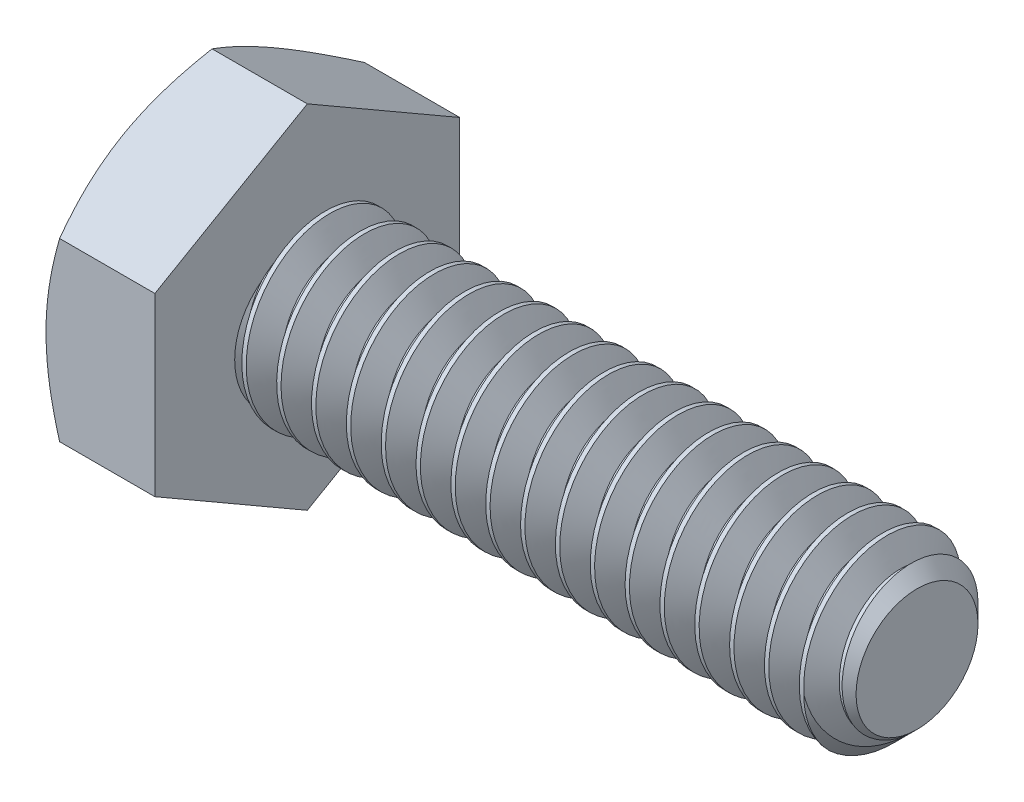
from build123d import *

# Parameters (mm, degrees)
SKETCH5_R           = 3.175
BOSS_EXTRUDE3_DEPTH = 22.225
CHAMFER1_SIZE       = 0.9525
CUT_SWEEP1_PITCH    = 1.27
BOSS_EXTRUDE4_DEPTH = 3.96875
SKETCH8_OUTSIDE_W   = 118.2
SKETCH8_OUTSIDE_H   = 119.92
SKETCH8_OUTSIDE_R   = 5.55625
CUT_EXTRUDE3_DEPTH  = 28.53446954
CUT_EXTRUDE3_DRAFT  = -60


with BuildPart() as part:
    # Sketch5 → Boss-Extrude3 (new body)
    with BuildSketch(Plane(origin=(13.096875, 0, 0), x_dir=(0, 0, -1), z_dir=(1, 0, 0))):
        Circle(SKETCH5_R)
    extrude(amount=-BOSS_EXTRUDE3_DEPTH)

    # Chamfer1
    chamfer1_edges = [part.edges().sort_by_distance(p)[0] for p in [
        (13.096875, 0, 3.175),
    ]]
    chamfer(chamfer1_edges, length=CHAMFER1_SIZE)

    # Cut-Sweep1: the profile of Sketch10 profile screwed along a right-hand helix of 18.5 turns, 8 arcs to a turn; built about Z, then put on its axis
    cut_sweep1_z = Axis((0, 0, 0), (0, 0, 1))
    cut_sweep1_corners = [(3.1753, 0, 0.000173205), (2.350110803, 0, -0.47625), (2.350110803, 0, -0.635), (3.1753, 0, -1.111423205)]
    with BuildLine(mode=Mode.PRIVATE) as cut_sweep1_profile:
        Line(cut_sweep1_corners[0], cut_sweep1_corners[1])
        Line(cut_sweep1_corners[1], cut_sweep1_corners[2])
        Line(cut_sweep1_corners[2], cut_sweep1_corners[3])
        Line(cut_sweep1_corners[3], cut_sweep1_corners[0])
    cut_sweep1_cap = Face(cut_sweep1_profile.wire())
    cut_sweep1_turn_angles = [0, 22.5, 45, 67.5, 90, 112.5, 135, 157.5, 180, 202.5, 225, 247.5, 270, 292.5, 315, 337.5, 360]
    cut_sweep1_turn_weights = [1, 0.9238795325112867, 1, 0.9238795325112867, 1, 0.9238795325112867, 1, 0.9238795325112867, 1, 0.9238795325112867, 1, 0.9238795325112867, 1, 0.9238795325112867, 1, 0.9238795325112867, 1]
    cut_sweep1_turn_rails = [Edge.make_bspline([Vector(p[0], p[1], 0).rotate(cut_sweep1_z, cut_sweep1_turn_angles[k]) / cut_sweep1_turn_weights[k] + Vector(0, 0, p[2] + CUT_SWEEP1_PITCH * cut_sweep1_turn_angles[k] / 360) for k in range(17)], [0, 0, 0, 1, 1, 2, 2, 3, 3, 4, 4, 5, 5, 6, 6, 7, 7, 8, 8, 8], 2, cut_sweep1_turn_weights) for p in cut_sweep1_corners]
    cut_sweep1_turn_sides = [Face.make_surface_from_curves(cut_sweep1_turn_rails[p[0]], cut_sweep1_turn_rails[p[1]]) for p in [(0, 1), (1, 2), (2, 3), (3, 0)]]
    cut_sweep1_last_angles = [6480, 6502.5, 6525, 6547.5, 6570, 6592.5, 6615, 6637.5, 6660]
    cut_sweep1_last_weights = [1, 0.9238795325112867, 1, 0.9238795325112867, 1, 0.9238795325112867, 1, 0.9238795325111926, 1]
    cut_sweep1_last_rails = [Edge.make_bspline([Vector(p[0], p[1], 0).rotate(cut_sweep1_z, cut_sweep1_last_angles[k]) / cut_sweep1_last_weights[k] + Vector(0, 0, p[2] + CUT_SWEEP1_PITCH * cut_sweep1_last_angles[k] / 360) for k in range(9)], [0, 0, 0, 1, 1, 2, 2, 3, 3, 4, 4, 4], 2, cut_sweep1_last_weights) for p in cut_sweep1_corners]
    cut_sweep1_last_sides = [Face.make_surface_from_curves(cut_sweep1_last_rails[p[0]], cut_sweep1_last_rails[p[1]]) for p in [(0, 1), (1, 2), (2, 3), (3, 0)]]
    cut_sweep1 = Plane(origin=(13.096875, 0, 0), x_dir=(0, 1, 0), z_dir=(-1, 0, 0)) * Solid(Shell([*[p.moved(Location((0, 0, CUT_SWEEP1_PITCH * i))) for i in range(18) for p in cut_sweep1_turn_sides], *cut_sweep1_last_sides, cut_sweep1_cap, cut_sweep1_cap.rotate(cut_sweep1_z, 6660).moved(Location((0, 0, CUT_SWEEP1_PITCH * 6660 / 360)))]))
    add(cut_sweep1, mode=Mode.SUBTRACT)

    # Sketch6 → Boss-Extrude4 (add)
    with BuildSketch(Plane.ZY.offset(9.128125)):
        Polygon((5.55625, 3.207902433), (0, 6.415804866), (-5.55625, 3.207902433), (-5.55625, -3.207902433), (0, -6.415804866), (5.55625, -3.207902433), align=None)
    extrude(amount=BOSS_EXTRUDE4_DEPTH)


with BuildPart() as cut_extrude3_tool:
    # Sketch8 outside → Cut-Extrude3 (with draft: the straight prism first)
    with BuildSketch(Plane.ZY.offset(13.096875)):
        Rectangle(SKETCH8_OUTSIDE_W, SKETCH8_OUTSIDE_H)
        Circle(SKETCH8_OUTSIDE_R, mode=Mode.SUBTRACT)
    extrude(amount=-CUT_EXTRUDE3_DEPTH)
    # Cut-Extrude3: the draft: its side faces are tilted about the plane it starts from
    cut_extrude3_sides = [cut_extrude3_tool.faces().sort_by_distance(p)[0] for p in [
        (1.17035977, -59.96, 0),
        (1.17035977, 0, 59.1),
        (1.17035977, 59.96, 0),
        (1.17035977, 0, -59.1),
        (1.17035977, 0, -5.55625),
    ]]
    draft(cut_extrude3_sides, Plane.ZY.offset(13.096875), CUT_EXTRUDE3_DRAFT)


with BuildPart() as part_1:
    add(part.part)

    # Cut-Extrude3: cut by cut_extrude3_tool
    add(cut_extrude3_tool.part, mode=Mode.SUBTRACT)


solid = part_1.part
